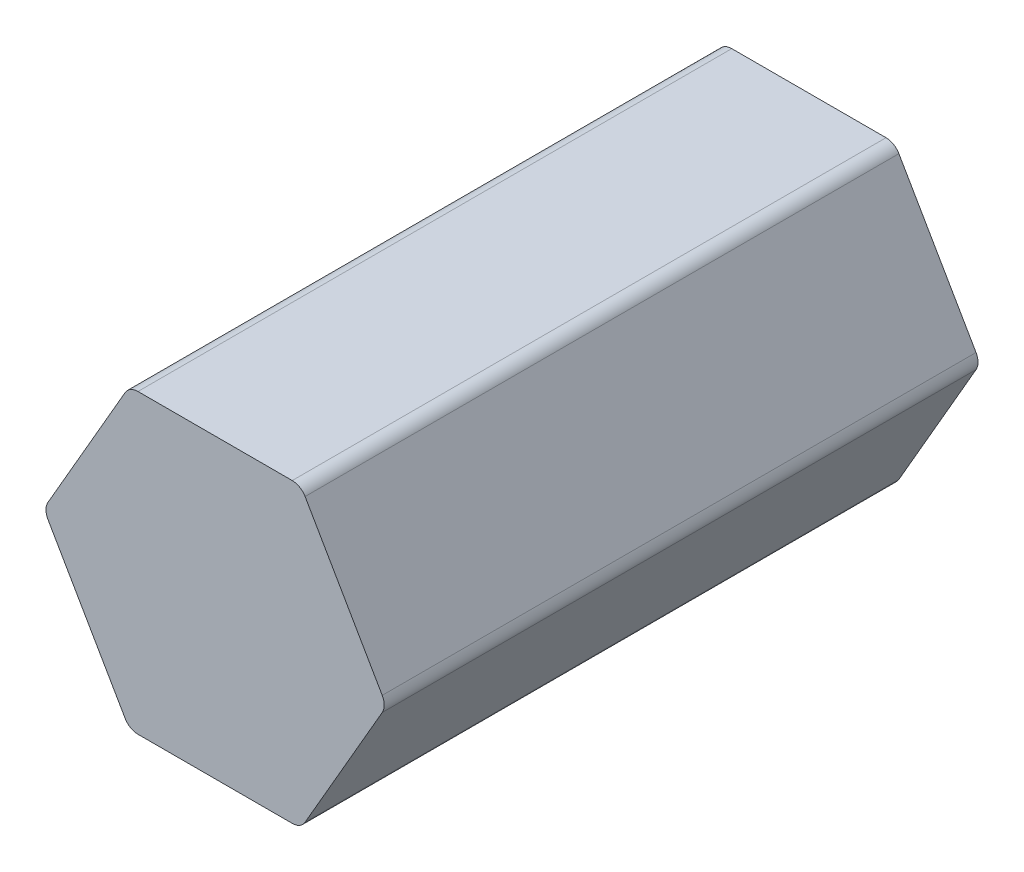
from build123d import *

# Parameters (mm, degrees)
BOSS_EXTRUDE1_DEPTH = 12.7
FILLET1_R           = 0.635


with BuildPart() as part:
    # Sketch1 → Boss-Extrude1 (new, symmetric)
    with BuildSketch(Plane.XY):
        Polygon((7.332348419, 0), (3.666174209, 6.35), (-3.666174209, 6.35), (-7.332348419, 0), (-3.666174209, -6.35), (3.666174209, -6.35), align=None)
    extrude(amount=BOSS_EXTRUDE1_DEPTH, both=True)

    # Fillet1
    fillet1_edges = [part.edges().sort_by_distance(p)[0] for p in [
        (3.666174209, -6.35, 0),
        (-3.666174209, -6.35, 0),
        (-7.332348419, 0, 0),
        (-3.666174209, 6.35, 0),
        (7.332348419, 0, 0),
        (3.666174209, 6.35, 0),
    ]]
    fillet(fillet1_edges, radius=FILLET1_R)


solid = part.part
